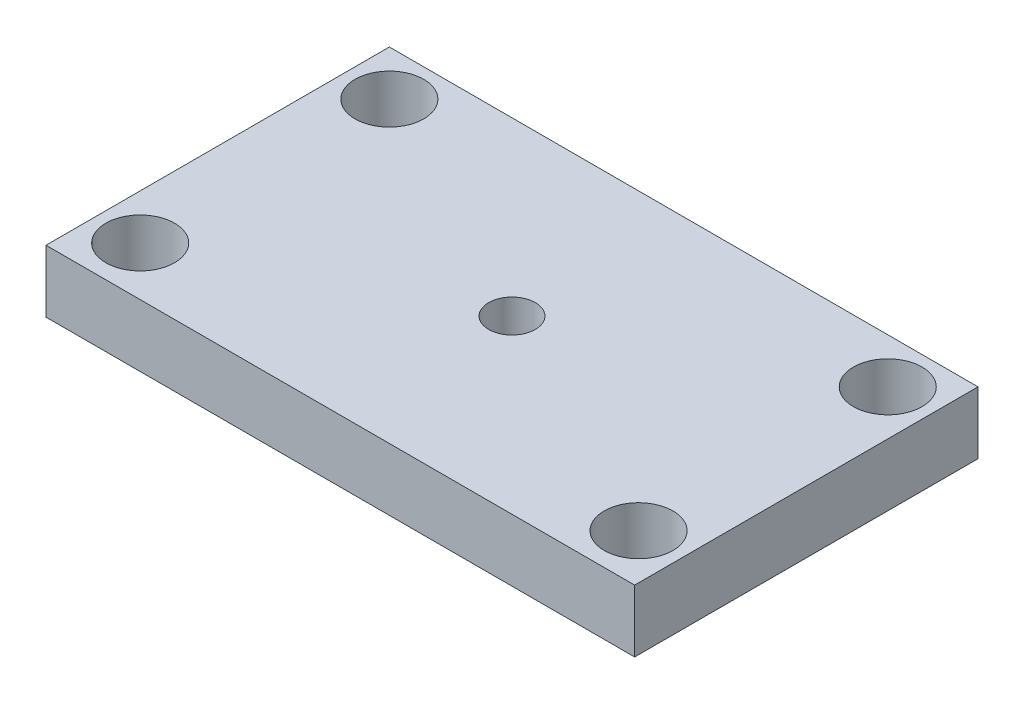
from build123d import *

# Parameters (mm, degrees)
SKETCH1_W           = 60
SKETCH1_H           = 35
SKETCH1_R           = 3.5
SKETCH1_R_2         = 2.375
BOSS_EXTRUDE1_DEPTH = 6.35


with BuildPart() as part:
    # Sketch1 → Boss-Extrude1 (new body)
    with BuildSketch(Plane(origin=(0, 0, 0), x_dir=(1, 0, 0), z_dir=(0, 1, 0))):
        with Locations((30, 17.5)):
            Rectangle(SKETCH1_W, SKETCH1_H)
        with Locations((4.6, 30.4)):
            Circle(SKETCH1_R, mode=Mode.SUBTRACT)
        with Locations((55.4, 30.4)):
            Circle(SKETCH1_R, mode=Mode.SUBTRACT)
        with Locations((4.6, 5)):
            Circle(SKETCH1_R, mode=Mode.SUBTRACT)
        with Locations((55.4, 5)):
            Circle(SKETCH1_R, mode=Mode.SUBTRACT)
        with Locations((30, 17.5)):
            Circle(SKETCH1_R_2, mode=Mode.SUBTRACT)
    extrude(amount=BOSS_EXTRUDE1_DEPTH)


solid = part.part
